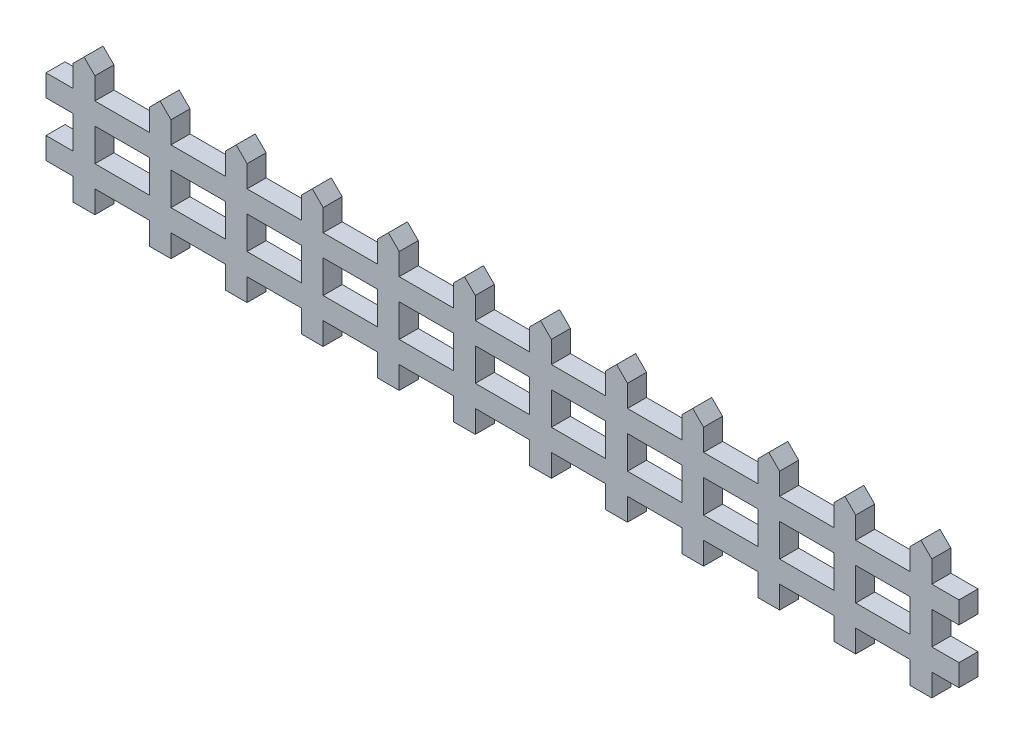
from build123d import *

# Parameters (mm, degrees)
SKETCH1_W                  = 6
SKETCH1_H                  = 10
BOSS_EXTRUDE1_DEPTH        = 3.5
CHAMFER1_SIZE              = 2
LPATTERN1_COUNT            = 6
LPATTERN1_PITCH            = 28
CHAMFER1_OF_LPATTERN1_SIZE = 2


with BuildPart() as part:
    # Sketch1 → Boss-Extrude1 (new body)
    with BuildSketch(Plane(origin=(0, 0, 0), x_dir=(0, 1, 0), z_dir=(0, 0, 1))):
        Polygon((84.991512901, 53.112203199), (82.991512901, 53.112203199), (80.857353011, 53.112203199), (80.857353011, 49.112203199), (82.991512901, 49.112203199), (84.991512901, 49.112203199), (84.991512901, 44.112203199), (88.991512901, 44.112203199), (88.991512901, 49.112203199), (94.991512901, 49.112203199), (94.991512901, 44.112203199), (98.991512901, 44.112203199), (98.991512901, 49.112203199), (100.991512901, 49.112203199), (105, 49.112203199), (105, 53.112203199), (100.991512901, 53.112203199), (98.991512901, 53.112203199), (98.991512901, 63.112203199), (100.991512901, 63.112203199), (105, 63.112203199), (105, 67.112203199), (100.991512901, 67.112203199), (98.991512901, 67.112203199), (98.991512901, 72.112203199), (94.991512901, 72.112203199), (94.991512901, 67.112203199), (88.991512901, 67.112203199), (88.991512901, 72.112203199), (84.991512901, 72.112203199), (84.991512901, 67.112203199), (82.991512901, 67.112203199), (80.857353011, 67.112203199), (80.857353011, 63.112203199), (82.991512901, 63.112203199), (84.991512901, 63.112203199), align=None)
        with Locations((91.991512901, 58.112203199)):
            Rectangle(SKETCH1_W, SKETCH1_H, mode=Mode.SUBTRACT)
    boss_extrude1 = extrude(amount=BOSS_EXTRUDE1_DEPTH)

    # Chamfer1
    chamfer1_edges = [part.edges().sort_by_distance(p)[0] for p in [
        (-49.112203199, 105, 1.75),
        (-53.112203199, 105, 1.75),
        (-63.112203199, 105, 1.75),
        (-67.112203199, 105, 1.75),
    ]]
    chamfer(chamfer1_edges, length=CHAMFER1_SIZE - 0.0001)  # a hair under: the kernel refuses the full size

    # LPattern1: Boss-Extrude1 ×6
    with Locations(*[(i * LPATTERN1_PITCH, 0, 0) for i in range(1, LPATTERN1_COUNT)]):
        add(boss_extrude1)

    # Chamfer1 of LPattern1
    chamfer1_of_lpattern1_edges = [part.edges().sort_by_distance(p)[0] for p in [
        (-21.112203199, 105, 1.75),
        (-25.112203199, 105, 1.75),
        (-35.112203199, 105, 1.75),
        (-39.112203199, 105, 1.75),
        (6.887796801, 105, 1.75),
        (2.887796801, 105, 1.75),
        (-7.112203199, 105, 1.75),
        (-11.112203199, 105, 1.75),
        (34.887796801, 105, 1.75),
        (30.887796801, 105, 1.75),
        (20.887796801, 105, 1.75),
        (16.887796801, 105, 1.75),
        (62.887796801, 105, 1.75),
        (58.887796801, 105, 1.75),
        (48.887796801, 105, 1.75),
        (44.887796801, 105, 1.75),
        (90.887796801, 105, 1.75),
        (86.887796801, 105, 1.75),
        (76.887796801, 105, 1.75),
        (72.887796801, 105, 1.75),
    ]]
    chamfer(chamfer1_of_lpattern1_edges, length=CHAMFER1_OF_LPATTERN1_SIZE - 0.0001)  # a hair under: the kernel refuses the full size


solid = part.part
